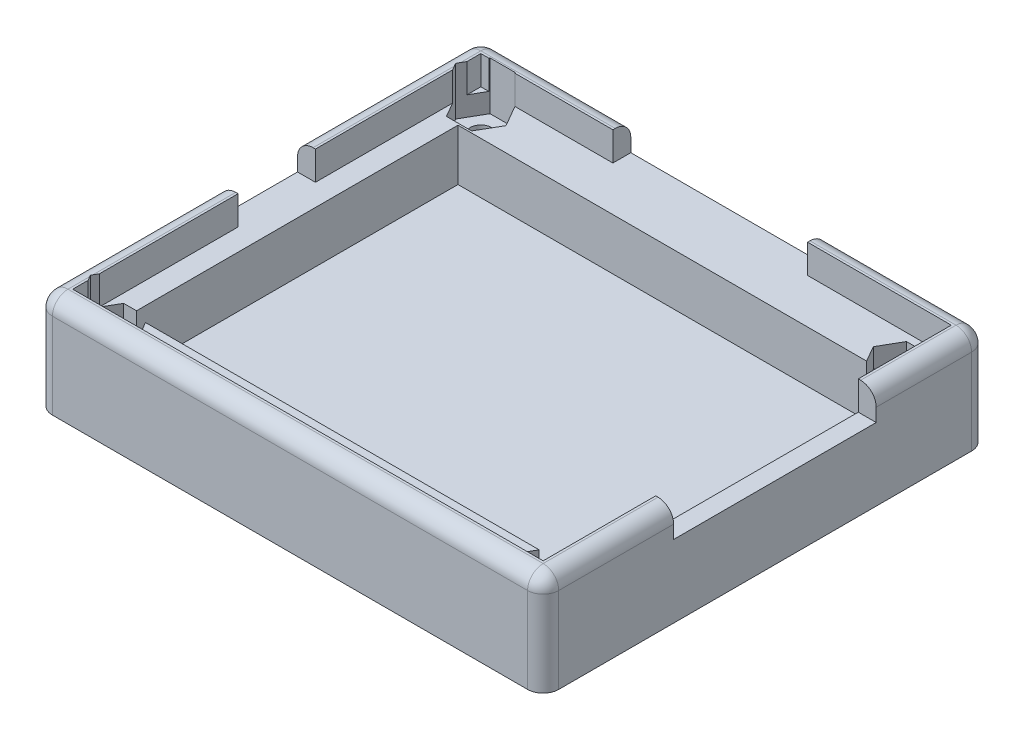
from build123d import *

# Parameters (mm, degrees)
SKETCH1_W                 = 82.55
SKETCH1_H                 = 72.39
BOSS_EXTRUDE1_DEPTH       = 16.51
SKETCH3_W                 = 76.708
SKETCH3_H                 = 66.548
CUT_EXTRUDE1_DEPTH        = 4.699
F_4_CLEARANCE_HOLE1_D     = 3.4544
F_4_CLEARANCE_HOLE1_DEPTH = 10.16
F_4_CLEARANCE_HOLE1_TIP   = 1.037806461
CUT_EXTRUDE2_DEPTH        = 8.255
CUT_EXTRUDE2_DEPTH_BACK   = 3.175
SKETCH9_W                 = 73.153706622
SKETCH9_H                 = 53.34
CUT_EXTRUDE3_DEPTH        = 8.382
SKETCH12_W                = 10.829569732
SKETCH12_H                = 12.611774214
SKETCH12_W_2              = 17.214227743
SKETCH12_H_2              = 33.027302542
SKETCH12_W_3              = 31.75
SKETCH12_H_3              = 19.685
CUT_EXTRUDE8_DEPTH        = 4.699
FILLET1_R                 = 2.54


with BuildPart() as part:
    # Sketch1 → Boss-Extrude1 (new body)
    with BuildSketch(Plane(origin=(0, 0, 0), x_dir=(1, 0, 0), z_dir=(0, 1, 0))):
        Rectangle(SKETCH1_W, SKETCH1_H)
    extrude(amount=BOSS_EXTRUDE1_DEPTH)

    # Sketch3 → Cut-Extrude1 (cut)
    with BuildSketch(Plane(origin=(0, 16.51, 0), x_dir=(1, 0, 0), z_dir=(0, 1, 0))):
        Rectangle(SKETCH3_W, SKETCH3_H)
    extrude(amount=-CUT_EXTRUDE1_DEPTH, mode=Mode.SUBTRACT)

    # #4 Clearance Hole1
    with Locations(Plane(origin=(0, 11.811, 0), x_dir=(1, 0, 0), z_dir=(0, 1, 0))):
        with Locations((-34.925, 29.845), (34.29, 28.575), (34.29, -29.845), (-34.925, -29.845)):
            Hole(F_4_CLEARANCE_HOLE1_D / 2, depth=F_4_CLEARANCE_HOLE1_DEPTH)
            with Locations((0, 0, -(F_4_CLEARANCE_HOLE1_DEPTH + F_4_CLEARANCE_HOLE1_TIP / 2))):  # 118° drill point
                Cone(0, F_4_CLEARANCE_HOLE1_D / 2, F_4_CLEARANCE_HOLE1_TIP, mode=Mode.SUBTRACT)

    # Sketch8 → Cut-Extrude2 (cut, two sides: drawn at the far end of the back side and taken through both)
    with BuildSketch(Plane(origin=(0, 11.811, 0), x_dir=(1, 0, 0), z_dir=(0, 1, 0)).offset(-CUT_EXTRUDE2_DEPTH_BACK)):
        Polygon((38.249468146, -29.845), (36.269734073, -26.416), (32.310265927, -26.416), (30.330531854, -29.845), (32.310265927, -33.274), (36.269734073, -33.274), align=None)
        Polygon((-30.818884886, 29.845), (-32.871942443, 33.401), (-36.978057557, 33.401), (-39.031115114, 29.845), (-36.978057557, 26.289), (-32.871942443, 26.289), align=None)
        Polygon((38.249468146, 28.575), (36.269734073, 32.004), (32.310265927, 32.004), (30.330531854, 28.575), (32.310265927, 25.146), (36.269734073, 25.146), align=None)
        Polygon((-30.965531854, -29.845), (-32.945265927, -26.416), (-36.904734073, -26.416), (-38.884468146, -29.845), (-36.904734073, -33.274), (-32.945265927, -33.274), align=None)
    extrude(amount=CUT_EXTRUDE2_DEPTH + CUT_EXTRUDE2_DEPTH_BACK, mode=Mode.SUBTRACT)

    # Sketch9 → Cut-Extrude3 (cut)
    with BuildSketch(Plane(origin=(0, 11.811, 0), x_dir=(1, 0, 0), z_dir=(0, 1, 0))):
        with Locations((1.777146689, -0.675914663)):
            Rectangle(SKETCH9_W, SKETCH9_H)
    extrude(amount=-CUT_EXTRUDE3_DEPTH, mode=Mode.SUBTRACT)

    # Sketch12 → Cut-Extrude8 (cut)
    with BuildSketch(Plane(origin=(0, 16.51, 0), x_dir=(1, 0, 0), z_dir=(0, 1, 0))):
        with Locations((-35.860215134, 0)):
            Rectangle(SKETCH12_W, SKETCH12_H)
        with Locations((32.667886129, 1.587498929)):
            Rectangle(SKETCH12_W_2, SKETCH12_H_2)
        with Locations((-0.9525, 26.3525)):
            Rectangle(SKETCH12_W_3, SKETCH12_H_3)
    extrude(amount=-CUT_EXTRUDE8_DEPTH, mode=Mode.SUBTRACT)

    # Fillet1
    # the kernel refuses this fillet: 2.54 mm, written as the material it takes off along each edge
    with BuildSketch(Plane(origin=(38.735, 13.97, 33.655), x_dir=(0, 1, 0), z_dir=(0, 0, 1))) as fillet1_piece_1_section:
        Polygon((0, 0), (FILLET1_R, 0), (FILLET1_R, -FILLET1_R), (0, -FILLET1_R), align=None)
    fillet1_piece_1 = extrude(amount=FILLET1_R, mode=Mode.PRIVATE)
    fillet1_piece_1 = fillet1_piece_1 - Plane(origin=(38.735, 13.97, 33.655), x_dir=(-0.7071067811865475, -0.7071067811865475, 0), z_dir=(0, 0, 1)) * Sphere(FILLET1_R, mode=Mode.PRIVATE)
    add(fillet1_piece_1, mode=Mode.SUBTRACT)
    with BuildSketch(Plane(origin=(38.735, 13.97, -33.655), x_dir=(0, 1, 0), z_dir=(0, 0, -1))) as fillet1_piece_2_section:
        Polygon((0, 0), (FILLET1_R, 0), (FILLET1_R, FILLET1_R), (0, FILLET1_R), align=None)
    fillet1_piece_2 = extrude(amount=FILLET1_R, mode=Mode.PRIVATE)
    fillet1_piece_2 = fillet1_piece_2 - Plane(origin=(38.735, 13.97, -33.655), x_dir=(-0.7071067811865475, -0.7071067811865475, 0), z_dir=(0, 0, -1)) * Sphere(FILLET1_R, mode=Mode.PRIVATE)
    add(fillet1_piece_2, mode=Mode.SUBTRACT)
    with BuildSketch(Plane(origin=(-38.735, 13.97, 33.655), x_dir=(0, 0, 1), z_dir=(-1, 0, 0))) as fillet1_piece_3_section:
        Polygon((0, 0), (FILLET1_R, 0), (FILLET1_R, FILLET1_R), (0, FILLET1_R), align=None)
    fillet1_piece_3 = extrude(amount=FILLET1_R, mode=Mode.PRIVATE)
    fillet1_piece_3 = fillet1_piece_3 - Plane(origin=(-38.735, 13.97, 33.655), x_dir=(0, -0.7071067811865475, -0.7071067811865475), z_dir=(-1, 0, 0)) * Sphere(FILLET1_R, mode=Mode.PRIVATE)
    add(fillet1_piece_3, mode=Mode.SUBTRACT)
    with BuildSketch(Plane(origin=(-38.735, 13.97, -33.655), x_dir=(-1, 0, 0), z_dir=(0, 0, -1))) as fillet1_piece_4_section:
        Polygon((0, 0), (FILLET1_R, 0), (FILLET1_R, FILLET1_R), (0, FILLET1_R), align=None)
    fillet1_piece_4 = extrude(amount=FILLET1_R, mode=Mode.PRIVATE)
    fillet1_piece_4 = fillet1_piece_4 - Plane(origin=(-38.735, 13.97, -33.655), x_dir=(0.7071067811865475, -0.7071067811865475, 0), z_dir=(0, 0, -1)) * Sphere(FILLET1_R, mode=Mode.PRIVATE)
    add(fillet1_piece_4, mode=Mode.SUBTRACT)
    with BuildSketch(Plane(origin=(41.275, 16.51, 8.576152342), x_dir=(-1, 0, 0), z_dir=(0, 0, 1))) as fillet1_piece_5:
        with BuildLine():
            CenterArc((FILLET1_R, FILLET1_R), FILLET1_R, 180, 90)
            Line((0, FILLET1_R), (0, 0))
            Line((0, 0), (FILLET1_R, 0))
        make_face()
    extrude(amount=25.078847658, mode=Mode.SUBTRACT)
    with BuildSketch(Plane(origin=(8.5725, 16.51, -36.195), x_dir=(0, -1, 0), z_dir=(1, 0, 0))) as fillet1_piece_6:
        with BuildLine():
            CenterArc((FILLET1_R, -FILLET1_R), FILLET1_R, 90, 90)
            Line((0, -FILLET1_R), (0, 0))
            Line((0, 0), (FILLET1_R, 0))
        make_face()
    extrude(amount=30.1625, mode=Mode.SUBTRACT)
    with BuildSketch(Plane(origin=(-41.275, 16.51, 33.655), x_dir=(0, -1, 0), z_dir=(0, 0, -1)), Plane(origin=(-41.275, 16.51, 0.044112893), x_dir=(0, -1, 0), z_dir=(0, 0, -1))) as fillet1_piece_7:
        with BuildLine():
            CenterArc((FILLET1_R, -FILLET1_R), FILLET1_R, 90, 90)
            Line((0, -FILLET1_R), (0, 0))
            Line((0, 0), (FILLET1_R, 0))
        make_face()
    extrude(amount=33.699112893, mode=Mode.SUBTRACT)
    with BuildSketch(Plane(origin=(41.275, 16.51, -33.655), x_dir=(-1, 0, 0), z_dir=(0, 0, 1))) as fillet1_piece_8:
        with BuildLine():
            CenterArc((FILLET1_R, FILLET1_R), FILLET1_R, 180, 90)
            Line((0, FILLET1_R), (0, 0))
            Line((0, 0), (FILLET1_R, 0))
        make_face()
    extrude(amount=21.9038498, mode=Mode.SUBTRACT)
    with BuildSketch(Plane(origin=(-38.735, 16.51, -36.195), x_dir=(0, -1, 0), z_dir=(1, 0, 0))) as fillet1_piece_9:
        with BuildLine():
            CenterArc((FILLET1_R, -FILLET1_R), FILLET1_R, 90, 90)
            Line((0, -FILLET1_R), (0, 0))
            Line((0, 0), (FILLET1_R, 0))
        make_face()
    extrude(amount=28.2575, mode=Mode.SUBTRACT)
    with BuildSketch(Plane(origin=(38.735, 16.51, 36.195), x_dir=(0, -1, 0), z_dir=(-1, 0, 0))) as fillet1_piece_10:
        with BuildLine():
            CenterArc((FILLET1_R, -FILLET1_R), FILLET1_R, 90, 90)
            Line((0, -FILLET1_R), (0, 0))
            Line((0, 0), (FILLET1_R, 0))
        make_face()
    extrude(amount=77.47, mode=Mode.SUBTRACT)
    with BuildSketch(Plane(origin=(-41.275, -6.35, -36.195), x_dir=(1, 0, 0), z_dir=(0, 1, 0)), Plane(origin=(41.275, -6.35, 36.195), x_dir=(-1, 0, 0), z_dir=(0, 1, 0)), Plane(origin=(-41.275, -6.35, 36.195), x_dir=(0, 0, -1), z_dir=(0, 1, 0))) as fillet1_piece_11:
        with BuildLine():
            CenterArc((FILLET1_R, -FILLET1_R), FILLET1_R, 90, 90)
            Line((0, -FILLET1_R), (0, 0))
            Line((0, 0), (FILLET1_R, 0))
        make_face()
    extrude(amount=20.32, mode=Mode.SUBTRACT)
    with BuildSketch(Plane(origin=(41.275, -6.35, -36.195), x_dir=(-1, 0, 0), z_dir=(0, 1, 0))) as fillet1_piece_12:
        with BuildLine():
            CenterArc((FILLET1_R, FILLET1_R), FILLET1_R, 180, 90)
            Line((0, FILLET1_R), (0, 0))
            Line((0, 0), (FILLET1_R, 0))
        make_face()
    extrude(amount=20.32, mode=Mode.SUBTRACT)


solid = part.part
